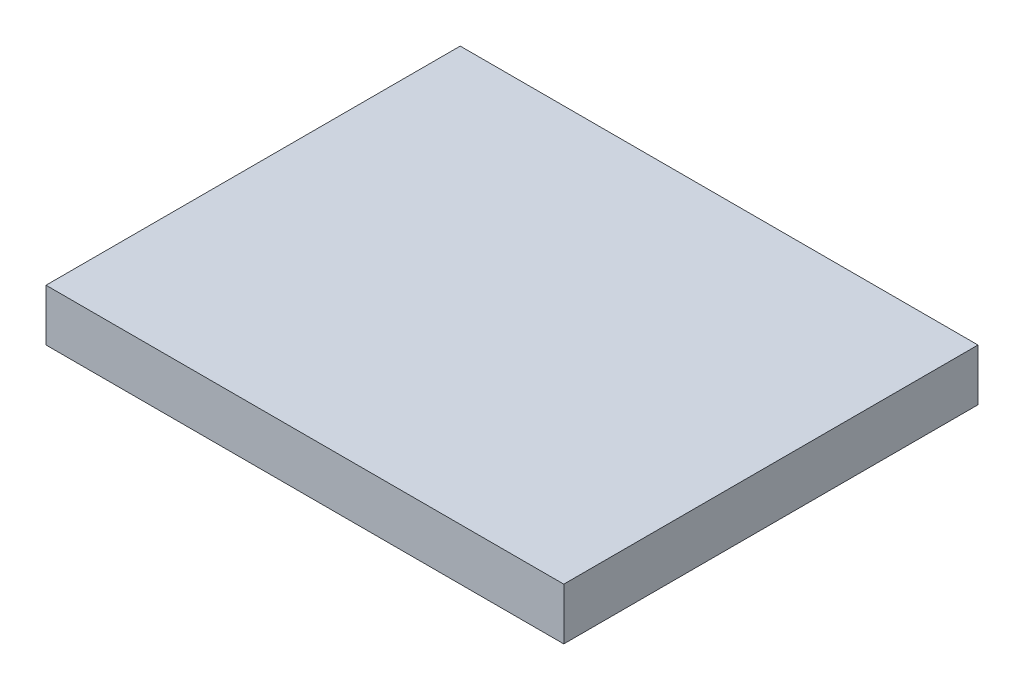
from build123d import *

# Parameters (mm, degrees)
SKETCH1_W           = 50
SKETCH1_H           = 40
BOSS_EXTRUDE1_DEPTH = 5


with BuildPart() as part:
    # Sketch1 → Boss-Extrude1 (new body)
    with BuildSketch(Plane(origin=(0, 0, 0), x_dir=(1, 0, 0), z_dir=(0, 1, 0))):
        Rectangle(SKETCH1_W, SKETCH1_H)
    extrude(amount=BOSS_EXTRUDE1_DEPTH)


solid = part.part
